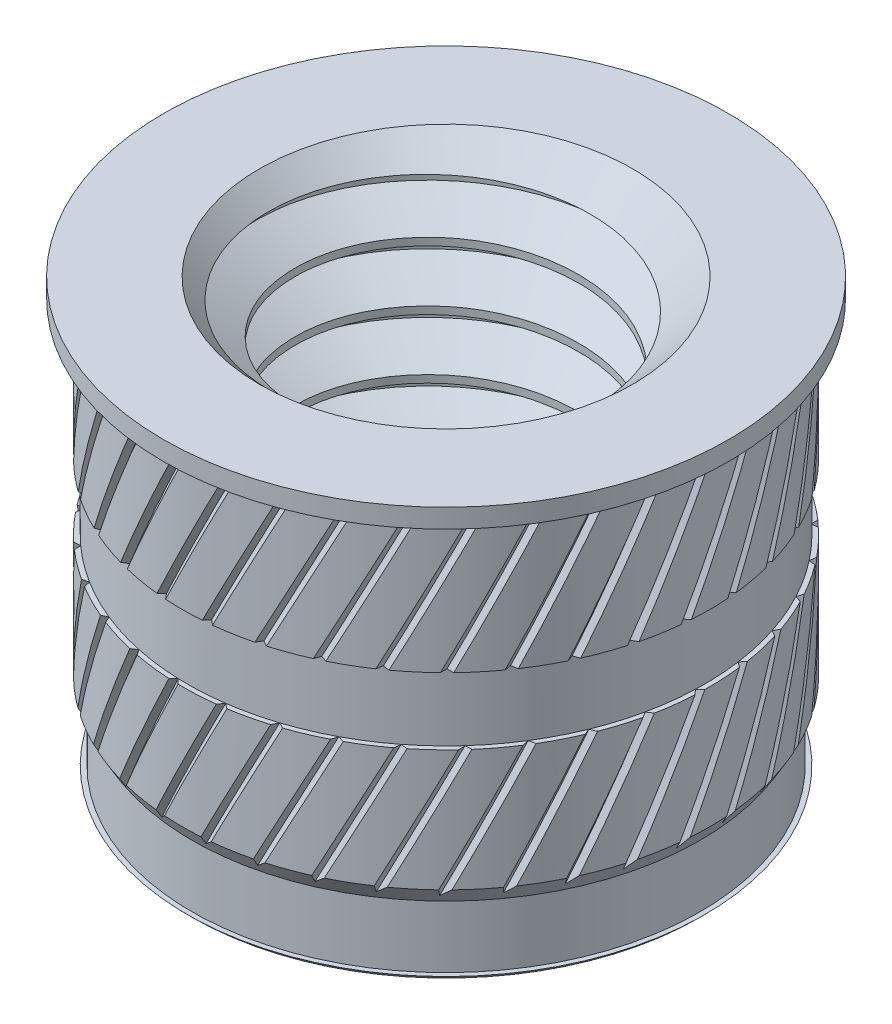
from build123d import *
from OCP.BRepAlgoAPI import BRepAlgoAPI_Cut
from OCP.TopTools import TopTools_ListOfShape

# Parameters (mm, degrees)
SKETCH1_R              = 3.3909
EXTRUDE1_DEPTH         = 5.715
SKETCH1_4_R            = 3.5179
EXTRUDE2_DEPTH         = 4.60489
SKETCH1_3_R            = 3.7719
EXTRUDE3_DEPTH         = 0.254
SKETCH2_R              = 3.5179
EXTRUDE4_DEPTH         = 0.21997
EXTRUDE4_TAPER         = 30
SKETCH8_R              = 1.897444252
EXTRUDE6_DEPTH         = 5.715
CHAMFER1_SIZE          = 0.5953125
CUT_SWEEP1_PITCH       = 0.79375
CUT_SWEEP1_HEIGHT      = 14.48839534
CUT_SWEEP1_RADIUS      = 2.413
CUT_SWEEP1_START_ANGLE = -90
CUT_SWEEP2_PITCH       = 44.60875
CUT_SWEEP2_HEIGHT      = 4.460875
CUT_SWEEP2_RADIUS      = 3.5179
CUT_SWEEP2_START_ANGLE = -180
CIRPATTERN1_COUNT      = 36
SKETCH11_W             = 0.3175
SKETCH11_H             = 0.892175


with BuildPart() as part:
    # Sketch1 → Extrude1 (new body)
    with BuildSketch(Plane(origin=(0, 0, 0), x_dir=(1, 0, 0), z_dir=(0, 1, 0))):
        with Locations(Location((0, 0, 0), (0, 0, 270))):
            Circle(SKETCH1_R)
    extrude(amount=-EXTRUDE1_DEPTH)

    # Sketch1<4> → Extrude2 (add)
    with BuildSketch(Plane(origin=(0, 0, 0), x_dir=(1, 0, 0), z_dir=(0, 1, 0))):
        with Locations(Location((0, 0, 0), (0, 0, 270))):
            Circle(SKETCH1_4_R)
    extrude(amount=-EXTRUDE2_DEPTH)

    # Sketch1<3> → Extrude3 (add)
    with BuildSketch(Plane(origin=(0, 0, 0), x_dir=(1, 0, 0), z_dir=(0, 1, 0))):
        with Locations(Location((0, 0, 0), (0, 0, 270))):
            Circle(SKETCH1_3_R)
    extrude(amount=-EXTRUDE3_DEPTH)

    # Sketch2 → Extrude4 (add)
    with BuildSketch(Plane.XZ.offset(4.604889774)):
        with Locations(Location((0, 0, 0), (0, 0, 90))):
            Circle(SKETCH2_R)
    extrude(amount=EXTRUDE4_DEPTH, taper=EXTRUDE4_TAPER)

    # Extrude5: read off the stored shape, not the designer's step
    # Extrude5 outline → Extrude5 (revolve)
    with BuildSketch(Plane.XY):
        Polygon((3.3909, -5.6515), (3.3909, -5.715), (3.4544, -5.6515), align=None)
    revolve(axis=Axis((0, 0, 0), (0, 1, 0)))

    # Sketch8 → Extrude6 (cut)
    with BuildSketch(Plane(origin=(0, 0, 0), x_dir=(1, 0, 0), z_dir=(0, 1, 0))):
        with Locations(Location((0, 0, 0), (0, 0, 270))):
            Circle(SKETCH8_R)
    extrude(amount=-EXTRUDE6_DEPTH, mode=Mode.SUBTRACT)

    # Chamfer1
    chamfer1_edges = [part.edges().sort_by_distance(p)[0] for p in [
        (0, -5.715, -1.897444252),
        (0, 0, -1.897444252),
    ]]
    chamfer(chamfer1_edges, length=CHAMFER1_SIZE)

    # Cut-Sweep1: sweep along a helix
    with BuildLine() as cut_sweep1_path:
        add(Helix(CUT_SWEEP1_PITCH, CUT_SWEEP1_HEIGHT, CUT_SWEEP1_RADIUS, center=(0, 0, 0), direction=(0, -1, 0), mode=Mode.PRIVATE).rotate(Axis((0, 0, 0), (0, -1, 0)), CUT_SWEEP1_START_ANGLE))
    # Sketch7 → Cut-Sweep1 (sweep, cut)
    with BuildSketch(Plane.XY):
        Polygon((-2.413, 0.396875), (-2.413, 0.29765625), (-1.854481273, -0.024804687), (-1.854481273, 0.719335938), align=None)
    sweep(path=cut_sweep1_path.line, is_frenet=True, mode=Mode.SUBTRACT)

    # Cut-Sweep2: sweep along a helix
    with BuildLine() as cut_sweep2_path:
        add(Helix(CUT_SWEEP2_PITCH, CUT_SWEEP2_HEIGHT, CUT_SWEEP2_RADIUS, center=(0, -0.254, 0), direction=(0, -1, 0), mode=Mode.PRIVATE).rotate(Axis((0, -0.254, 0), (0, -1, 0)), CUT_SWEEP2_START_ANGLE))
    # Sketch10 → Cut-Sweep2 (sweep, cut)
    with BuildSketch(Plane.XZ.offset(0.254)):
        Polygon((0, 3.4544), (-0.0635, 3.5179), (0.0635, 3.5179), align=None)
    cut_sweep2 = sweep(path=cut_sweep2_path.line, is_frenet=True, mode=Mode.SUBTRACT)

    # CirPattern1: Cut-Sweep2 ×36 about axis
    cirpattern1_axis = Axis((0, -4.604889774, 0), (0, 1, 0))
    for i in range(1, CIRPATTERN1_COUNT):
        add(cut_sweep2.rotate(cirpattern1_axis, i * 360 / CIRPATTERN1_COUNT), mode=Mode.SUBTRACT)


with BuildPart() as cut_revolve1_tool:
    # Sketch11 → Cut-Revolve1 (revolve)
    with BuildSketch(Plane.XY):
        with Locations((-3.61315, -2.539430113)):
            Rectangle(SKETCH11_W, SKETCH11_H)
    revolve(axis=Axis((0, 0, 0), (0, -1, 0)))


with BuildPart() as part_1:
    add(part.part)

    # Cut-Revolve1: cut by cut_revolve1_tool, with a tolerance
    cut_revolve1_stock = TopTools_ListOfShape()
    cut_revolve1_stock.Append(part_1.part.wrapped)
    cut_revolve1_tools = TopTools_ListOfShape()
    cut_revolve1_tools.Append(cut_revolve1_tool.part.wrapped)
    cut_revolve1_cut = BRepAlgoAPI_Cut()
    cut_revolve1_cut.SetArguments(cut_revolve1_stock)
    cut_revolve1_cut.SetTools(cut_revolve1_tools)
    cut_revolve1_cut.SetFuzzyValue(0.00001)
    cut_revolve1_cut.Build()
    add(Compound.cast(cut_revolve1_cut.Shape()).solids(), mode=Mode.REPLACE)


solid = part_1.part
